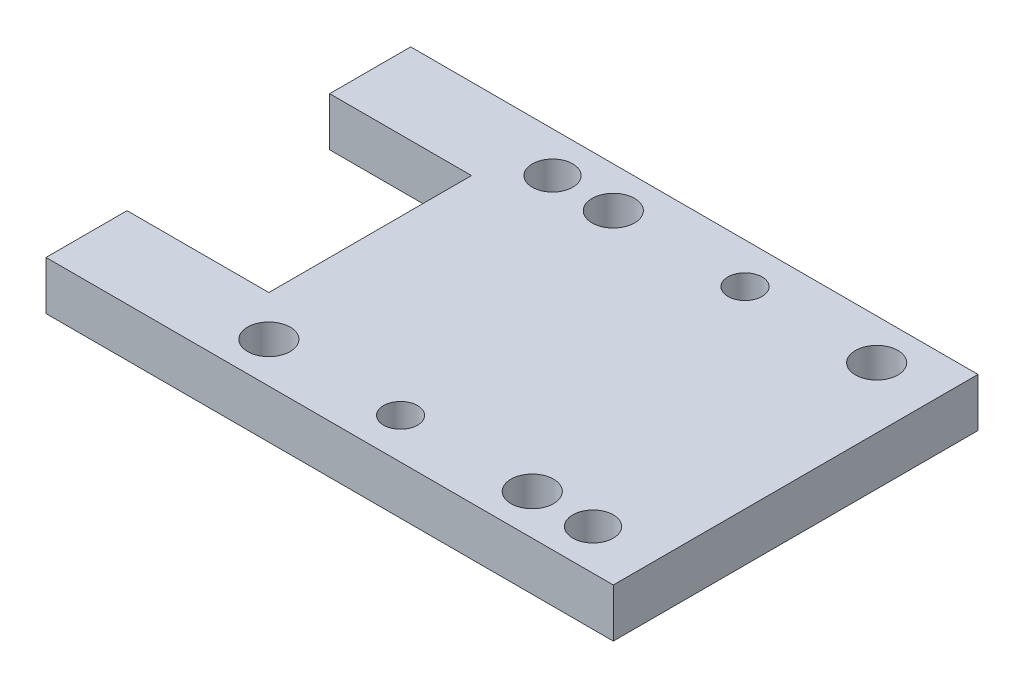
from build123d import *

# Parameters (mm, degrees)
SKETCH1_W              = 140
SKETCH1_H              = 90
BOSS_EXTRUDE1_DEPTH    = 12
CUT_EXTRUDE1_REACH     = 86.077
SKETCH2_W              = 35
SKETCH2_H              = 50
M10_CLEARANCE_HOLE1_D  = 10.5
F_10_0MM_DOWEL_HOLE1_D = 10
M8_TAPPED_HOLE1_D      = 6.8
M8_TAPPED_HOLE1_DEPTH  = 20.207073895
M8_TAPPED_HOLE1_TIP    = 2.042926105
M8_CLEARANCE_HOLE1_D   = 8.4


with BuildPart() as part:
    # Sketch1 → Boss-Extrude1 (new body)
    with BuildSketch(Plane(origin=(0, 0, 0), x_dir=(1, 0, 0), z_dir=(0, 1, 0))):
        Rectangle(SKETCH1_W, SKETCH1_H)
    extrude(amount=-BOSS_EXTRUDE1_DEPTH)

    # Sketch2 → Cut-Extrude1 (cut, up to next)
    with BuildSketch(Plane(origin=(0, 0, 0), x_dir=(1, 0, 0), z_dir=(0, 1, 0)), mode=Mode.PRIVATE) as cut_extrude1_sk1:
        with Locations((-52.5, 0)):
            Rectangle(SKETCH2_W, SKETCH2_H)
    cut_extrude1_tool1 = extrude(cut_extrude1_sk1.sketch, amount=-CUT_EXTRUDE1_REACH, mode=Mode.PRIVATE) & part.part
    add(cut_extrude1_tool1.solids().sort_by_distance((-52.5, 0, 0))[0], mode=Mode.SUBTRACT)

    # M10 Clearance Hole1 (through all)
    with Locations(Plane(origin=(0, 0, 0), x_dir=(1, 0, 0), z_dir=(0, 1, 0))):
        with Locations((-10, 35), (55, 35), (40, -35), (-25, -35)):
            Hole(M10_CLEARANCE_HOLE1_D / 2)

    # Ø10.0mm Dowel Hole1 (through all)
    with Locations(Plane(origin=(0, 0, 0), x_dir=(1, 0, 0), z_dir=(0, 1, 0))):
        with Locations((-25, 35), (55, -35)):
            Hole(F_10_0MM_DOWEL_HOLE1_D / 2)

    # M8 Tapped Hole1
    with Locations(Plane.ZY.offset(70)):
        with Locations((35, -6), (-35, -6)):
            Hole(M8_TAPPED_HOLE1_D / 2, depth=M8_TAPPED_HOLE1_DEPTH)
            with Locations((0, 0, -(M8_TAPPED_HOLE1_DEPTH + M8_TAPPED_HOLE1_TIP / 2))):  # 118° drill point
                Cone(0, M8_TAPPED_HOLE1_D / 2, M8_TAPPED_HOLE1_TIP, mode=Mode.SUBTRACT)

    # M8 Clearance Hole1 (through all)
    with Locations(Plane(origin=(0, 0, 0), x_dir=(1, 0, 0), z_dir=(0, 1, 0))):
        with Locations((22.5, 35), (7.5, -35)):
            Hole(M8_CLEARANCE_HOLE1_D / 2)


solid = part.part
